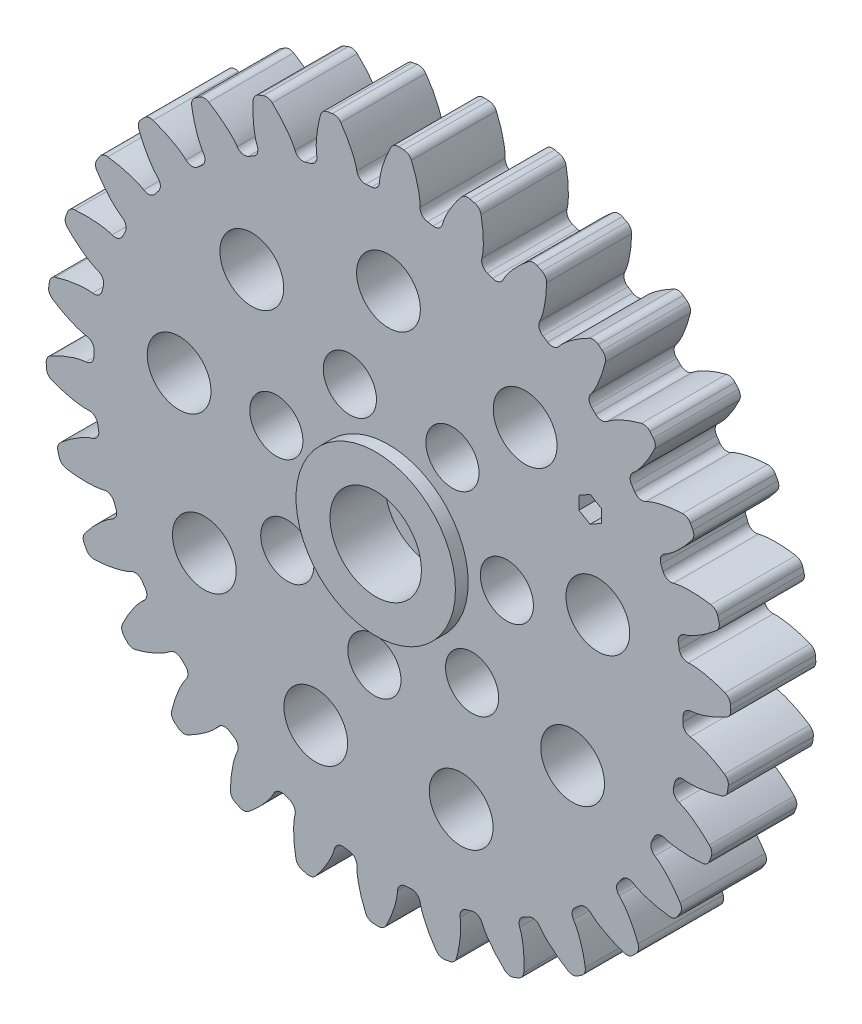
from build123d import *

# Parameters (mm, degrees)
SCHEIBE_R                       = 16.126984127
BODY_DEPTH                      = 2
ZAHNSCHNITT_START               = -2
ZAHNSCHNITT_DEPTH               = 4
Z_HNEMUSTER_COUNT               = 30
VERRUNDUNG3_R                   = 0.4
VERRUNDUNG4_R                   = 0.4
VERRUNDUNG5_R                   = 0.4
VERRUNDUNG6_R                   = 0.4
VERRUNDUNG7_R                   = 0.4
VERRUNDUNG8_R                   = 0.4
VERRUNDUNG10_R                  = 0.4
SKIZZE3_R                       = 1.5
SCHNITT_LINEAR_AUSTRAGEN2_DEPTH = 24.130751212
KREISMUSTER3_COUNT              = 9
SKIZZE5_R                       = 1.25
SCHNITT_LINEAR_AUSTRAGEN4_DEPTH = 24.130751212
KREISMUSTER6_COUNT              = 7
AUFTRAG_UNTEN_R                 = 3.75
AUFTRAG_DEPTH                   = 0.6
LOCHSKIZZE_R                    = 2.15
LOCH_FUER_SERVOAUFSATZ_DEPTH    = 2.6
ANKERSCHRAUBE_R                 = 1
SCHRAUBE_DEPTH                  = 23.930147205
GEGENLOCH_R                     = 1.75
SCHRAUBEN_GEGENLOCH_DEPTH       = 1.2
VERRUNDUNG17_R                  = 1
MARKER_DEPTH                    = 10


# Read off the part's stored shape, not the designer's step: zahnschnitt
with BuildPart() as part:
    # Scheibe → body (new, symmetric)
    with BuildSketch(Plane.XY):
        Circle(SCHEIBE_R)
    extrude(amount=BODY_DEPTH, both=True)

    # zahnschnitt outline → zahnschnitt (cut)
    with BuildSketch(Plane.XY.offset(ZAHNSCHNITT_START)):
        with BuildLine():
            ThreePointArc((16.012680969, -1.916680785), (16.115673063, -0.603902925), (16.111219347, 0.712901254))
            add(Edge.make_bspline(
                [(16.111219347, 0.712901254), (16.101200611, 0.706937352), (16.045194669, 0.673753292), (15.942521902, 0.614494708), (15.791619942, 0.531564001), (15.60112127, 0.434569186), (15.407406285, 0.343747932), (15.210636165, 0.260014923), (15.01088324, 0.184043183), (14.824933141, 0.122552144), (14.653857856, 0.074338059), (14.507236427, 0.040365071), (14.39296075, 0.019045288), (14.30272625, 0.006727513), (14.247197661, 0.001533541), (14.217760952, 0.000222272), (14.207257481, 0)],
                knots=[0.646812802, 0.646812802, 0.646812802, 0.646812802, 0.646812802, 0.652783571, 0.680149903, 0.707515961, 0.734882063, 0.762248421, 0.789614741, 0.816980391, 0.844236067, 0.862480777, 0.880559096, 0.894007228, 0.903714168, 0.909090916, 0.909090916, 0.909090916, 0.909090916, 0.909090916], degree=4))
            Line((14.207257481, 0), (13.859126984, 0))
            ThreePointArc((13.859126984, 0), (13.849406539, -0.518979076), (13.820258839, -1.037230155))
            Line((13.820258839, -1.037230155), (14.167412998, -1.06328457))
            add(Edge.make_bspline(
                [(14.167412998, -1.06328457), (14.177870377, -1.064292308), (14.207126394, -1.067802971), (14.26211053, -1.077138188), (14.351170091, -1.096174653), (14.463529688, -1.125987144), (14.607197345, -1.17083814), (14.774184459, -1.231720444), (14.95501101, -1.306955712), (15.148517928, -1.397664085), (15.338469545, -1.495888726), (15.524844105, -1.600953083), (15.707549337, -1.711932974), (15.851821477, -1.805924746), (15.949771328, -1.872701265), (16.003136675, -1.909983798), (16.012680969, -1.916680785)],
                knots=[0, 0, 0, 0, 0, 0.005376748, 0.015083688, 0.02853182, 0.046610139, 0.064854849, 0.092110525, 0.119476175, 0.146842495, 0.174208853, 0.201574955, 0.228941013, 0.256307345, 0.262278114, 0.262278114, 0.262278114, 0.262278114, 0.262278114], degree=4))
        make_face()
    zahnschnitt = extrude(amount=ZAHNSCHNITT_DEPTH, mode=Mode.SUBTRACT)

    # zähnemuster: zahnschnitt ×30 about axis
    z_hnemuster_axis = Axis((0, 0, 2), (0, 0, 1))
    for i in range(1, Z_HNEMUSTER_COUNT):
        add(zahnschnitt.rotate(z_hnemuster_axis, i * 360 / Z_HNEMUSTER_COUNT), mode=Mode.SUBTRACT)

    # Verrundung3
    verrundung3_edges = [part.edges().sort_by_distance(p)[0] for p in [
        (-3.125318795, 15.821251514, 0),
        (-2.393076906, 15.948441929, 0),
    ]]
    fillet(verrundung3_edges, radius=VERRUNDUNG3_R)

    # Verrundung4
    verrundung4_edges = [part.edges().sort_by_distance(p)[0] for p in [
        (16.111219347, 0.712901254, 0),
        (16.061265814, 1.454426864, 0),
        (13.7339053, 1.858829195, 0),
        (13.556271808, 2.881474525, 0),
        (15.610930044, 4.047033507, 0),
        (15.407896272, 4.761969079, 0),
        (12.660942503, 5.637014785, 0),
        (14.428368189, 7.204290975, 0),
        (14.081127728, 7.861390395, 0),
        (11.790492856, 7.284207506, 0),
        (11.212269257, 8.146190451, 0),
        (12.615217408, 10.046686358, 0),
        (12.138946334, 10.617231228, 0),
        (10.018370399, 9.5764114, 0),
        (9.273566042, 10.299338504, 0),
        (10.250721093, 12.449993338, 0),
        (9.666234735, 12.909048109, 0),
        (7.808397083, 11.450080164, 0),
        (6.929563492, 12.002356042, 0),
        (7.438219077, 14.309175867, 0),
        (6.771062295, 14.636677644, 0),
        (5.257159346, 12.823325481, 0),
        (4.282705765, 13.180813028, 0),
        (3.579961942, 15.72461413, 0),
        (4.300631195, 15.542978748, 0),
        (0.232400073, 16.125309524, 0),
        (0.975085093, 16.097478874, 0),
        (2.476158518, 13.636129941, 0),
        (1.448673246, 13.783205236, 0),
        (-0.413062319, 13.852970089, 0),
        (-1.448673246, 13.783205236, 0),
    ]]
    fillet(verrundung4_edges, radius=VERRUNDUNG4_R)

    # Verrundung5
    verrundung5_edges = [part.edges().sort_by_distance(p)[0] for p in [
        (5.656649961, -15.102381543, 0),
        (6.346446234, -14.825728894, 0),
        (6.011861756, -12.487310319, 0),
        (6.929563492, -12.002356042, 0),
        (8.67300027, -13.596274613, 0),
        (9.290203519, -13.18225078, 0),
        (8.476745954, -10.964496286, 0),
        (9.273566042, -10.299338504, 0),
        (11.310298849, -11.495945241, 0),
        (11.827934331, -10.962645051, 0),
        (10.571155679, -8.962481151, 0),
        (11.212269257, -8.146190451, 0),
        (13.453283095, -8.893187899, 0),
        (13.848727656, -8.263919129, 0),
        (12.203555174, -6.568762583, 0),
        (12.660942503, -5.637014785, 0),
        (15.008294314, -5.901755571, 0),
        (15.264265128, -5.204020286, 0),
        (13.30260075, -3.88795757, 0),
        (13.556271808, -2.881474525, 0),
        (15.907371054, -2.652388204, 0),
        (16.012680969, -1.916680785, 0),
        (13.859126984, 0, 0),
        (13.820258839, -1.037230155, 0),
    ]]
    fillet(verrundung5_edges, radius=VERRUNDUNG5_R)

    # Verrundung6
    verrundung6_edges = [part.edges().sort_by_distance(p)[0] for p in [
        (-14.428368189, -7.204290975, 0),
        (-14.081127728, -7.861390395, 0),
        (-11.790492856, -7.284207506, 0),
        (-11.212269257, -8.146190451, 0),
        (-12.615217408, -10.046686358, 0),
        (-12.138946334, -10.617231228, 0),
        (-9.273566042, -10.299338504, 0),
        (-7.808397083, -11.450080164, 0),
        (-9.666234735, -12.909048109, 0),
        (-10.250721093, -12.449993338, 0),
        (-10.018370399, -9.5764114, 0),
        (-6.929563492, -12.002356042, 0),
        (-7.438219077, -14.309175867, 0),
        (-6.771062295, -14.636677644, 0),
        (-5.257159346, -12.823325481, 0),
        (-4.282705765, -13.180813028, 0),
        (-4.300631195, -15.542978748, 0),
        (-3.579961942, -15.72461413, 0),
        (-2.476158518, -13.636129941, 0),
        (-1.448673246, -13.783205236, 0),
        (-0.975085093, -16.097478874, 0),
        (-0.232400073, -16.125309524, 0),
        (0.413062319, -13.852970089, 0),
        (1.448673246, -13.783205236, 0),
        (2.393076906, -15.948441929, 0),
        (3.125318795, -15.821251514, 0),
        (3.28423035, -13.464368971, 0),
        (4.282705765, -13.180813028, 0),
    ]]
    fillet(verrundung6_edges, radius=VERRUNDUNG6_R)

    # Verrundung7
    verrundung7_edges = [part.edges().sort_by_distance(p)[0] for p in [
        (13.047314197, 4.67364879, 0),
    ]]
    fillet(verrundung7_edges, radius=VERRUNDUNG7_R)

    # Verrundung8
    verrundung8_edges = [part.edges().sort_by_distance(p)[0] for p in [
        (-15.264265128, 5.204020286, 0),
        (-15.008294314, 5.901755571, 0),
        (-9.273566042, 10.299338504, 0),
        (-8.476745954, 10.964496286, 0),
        (-9.290203519, 13.18225078, 0),
        (-6.011861756, 12.487310319, 0),
        (-8.67300027, 13.596274613, 0),
        (-6.929563492, 12.002356042, 0),
        (-6.346446234, 14.825728894, 0),
        (-5.656649961, 15.102381543, 0),
        (-4.282705765, 13.180813028, 0),
        (-3.28423035, 13.464368971, 0),
    ]]
    fillet(verrundung8_edges, radius=VERRUNDUNG8_R)

    # Verrundung10
    verrundung10_edges = [part.edges().sort_by_distance(p)[0] for p in [
        (-12.660942503, -5.637014785, 0),
        (-13.047314197, -4.67364879, 0),
        (-15.610930044, -4.047033507, 0),
        (-13.556271808, -2.881474525, 0),
        (-13.7339053, -1.858829195, 0),
        (-16.061265814, -1.454426864, 0),
        (-15.407896272, -4.761969079, 0),
        (-16.111219347, -0.712901254, 0),
        (-13.859126984, 0, 0),
        (-13.820258839, 1.037230155, 0),
        (-16.012680969, 1.916680785, 0),
        (-15.907371054, 2.652388204, 0),
        (-13.556271808, 2.881474525, 0),
        (-13.30260075, 3.88795757, 0),
        (-12.660942503, 5.637014785, 0),
        (-12.203555174, 6.568762583, 0),
        (-13.848727656, 8.263919129, 0),
        (-13.453283095, 8.893187899, 0),
        (-11.212269257, 8.146190451, 0),
        (-10.571155679, 8.962481151, 0),
        (-11.827934331, 10.962645051, 0),
        (-11.310298849, 11.495945241, 0),
    ]]
    fillet(verrundung10_edges, radius=VERRUNDUNG10_R)

    # Skizze3 → Schnitt-Linear austragen2 (cut, through all)
    with BuildSketch(Plane.XY.offset(2)):
        with Locations((0, 10)):
            Circle(SKIZZE3_R)
    schnitt_linear_austragen2 = extrude(amount=-SCHNITT_LINEAR_AUSTRAGEN2_DEPTH, mode=Mode.SUBTRACT)

    # Kreismuster3: Schnitt-Linear austragen2 ×9 about axis
    kreismuster3_axis = Axis((0, 0, 0), (0, 0, 1))
    for i in range(1, KREISMUSTER3_COUNT):
        add(schnitt_linear_austragen2.rotate(kreismuster3_axis, i * 360 / KREISMUSTER3_COUNT), mode=Mode.SUBTRACT)

    # Skizze5 → Schnitt-Linear austragen4 (cut, through all)
    with BuildSketch(Plane.XY.offset(2)):
        with Locations((-1.815670093, 5.297484508)):
            Circle(SKIZZE5_R)
    schnitt_linear_austragen4 = extrude(amount=-SCHNITT_LINEAR_AUSTRAGEN4_DEPTH, mode=Mode.SUBTRACT)

    # Kreismuster6: Schnitt-Linear austragen4 ×7 about axis
    kreismuster6_axis = Axis((0, 0, 0), (0, 0, 1))
    for i in range(1, KREISMUSTER6_COUNT):
        add(schnitt_linear_austragen4.rotate(kreismuster6_axis, i * 360 / KREISMUSTER6_COUNT), mode=Mode.SUBTRACT)

    # Auftrag unten → Auftrag (add)
    with BuildSketch(Plane.XY.offset(2)):
        Circle(AUFTRAG_UNTEN_R)
    extrude(amount=AUFTRAG_DEPTH)

    # LochSkizze → Loch fuer Servoaufsatz (cut)
    with BuildSketch(Plane.XY.offset(2.6)):
        Circle(LOCHSKIZZE_R)
    extrude(amount=-LOCH_FUER_SERVOAUFSATZ_DEPTH, mode=Mode.SUBTRACT)

    # Ankerschraube → Schraube (cut, through all)
    with BuildSketch(Plane.XY):
        Circle(ANKERSCHRAUBE_R)
    extrude(amount=-SCHRAUBE_DEPTH, mode=Mode.SUBTRACT)

    # gegenloch → Schrauben gegenloch (cut)
    with BuildSketch(Plane(origin=(0, 0, -2), x_dir=(-1, 0, 0), z_dir=(0, 0, -1))):
        Circle(GEGENLOCH_R)
    extrude(amount=-SCHRAUBEN_GEGENLOCH_DEPTH, mode=Mode.SUBTRACT)

    # Verrundung17
    verrundung17_edges = [part.edges().sort_by_distance(p)[0] for p in [
        (1.75, 0, -2),
    ]]
    fillet(verrundung17_edges, radius=VERRUNDUNG17_R)

    # markersechskant → Marker (cut)
    with BuildSketch(Plane(origin=(0, 0, -2), x_dir=(-1, 0, 0), z_dir=(0, 0, -1))):
        Polygon((-10.018865785, 6.152875007), (-10.014050502, 5.542351603), (-9.482914083, 5.241260058), (-8.956592946, 5.550691918), (-8.961408229, 6.161215323), (-9.492544649, 6.462306867), align=None)
    extrude(amount=-MARKER_DEPTH, mode=Mode.SUBTRACT)


solid = part.part
